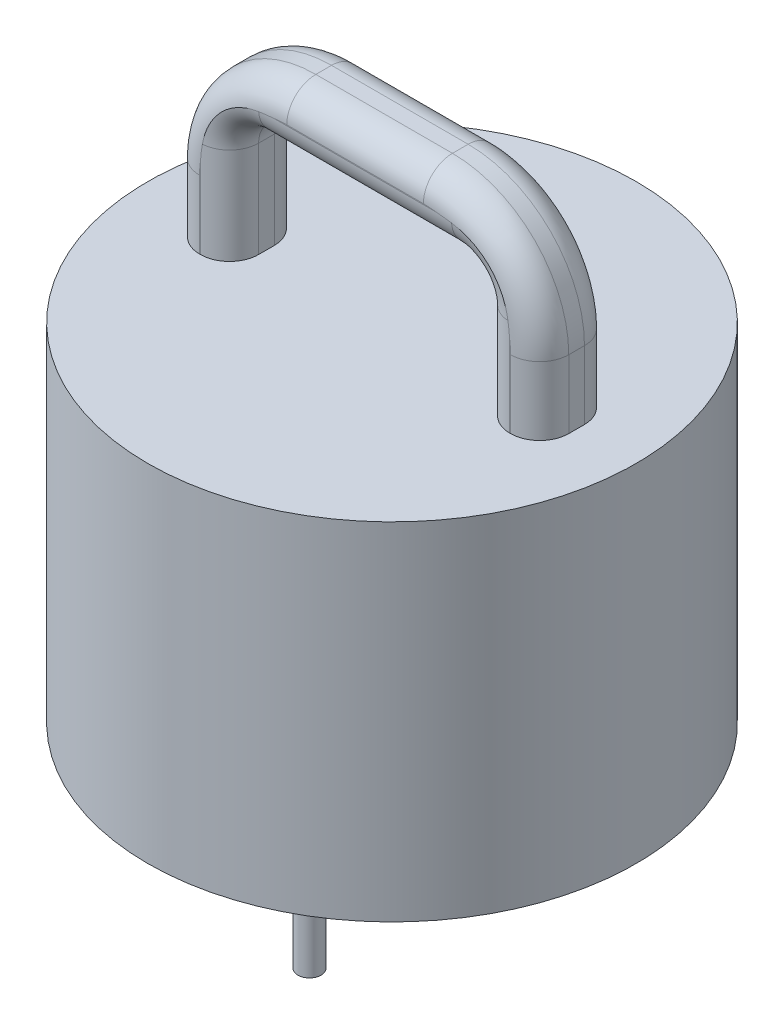
from build123d import *

# Parameters (mm, degrees)
SKETCH1_R           = 84
BOSS_EXTRUDE1_DEPTH = 203
SKETCH2_OUTSIDE_W   = 232.5
SKETCH2_OUTSIDE_H   = 232.5
SKETCH2_OUTSIDE_W_2 = 127
SKETCH2_OUTSIDE_H_2 = 25.4
CUT_EXTRUDE1_DEPTH  = 63.5
CUT_EXTRUDE2_REACH  = 242.033
SKETCH3_W           = 86.36
SKETCH3_H           = 43.18
FILLET1_R           = 10
FILLET1_R_2         = 40
SKETCH4_OUTSIDE_W   = 232.5
SKETCH4_OUTSIDE_H   = 232.5
SKETCH4_OUTSIDE_R   = 4
CUT_EXTRUDE3_DEPTH  = 20.32
SPLIT1_START        = 20.32
SPLIT1_OUTLINE_R    = 84
SPLIT1_DEPTH        = 119.18
SPLIT1_2_OUTLINE_R  = 4
SPLIT1_2_DEPTH      = 20.32
SPLIT1_3_OUTLINE_R  = 84
SPLIT1_3_DEPTH      = 139.5


# Read off the part's stored shape, not the designer's step: Split1
with BuildPart() as part:
    # Sketch1 → Boss-Extrude1 (new body)
    with BuildSketch(Plane(origin=(0, 0, 0), x_dir=(1, 0, 0), z_dir=(0, 1, 0))):
        with Locations(Location((0, 0, 0), (0, 0, 90))):
            Circle(SKETCH1_R)
    extrude(amount=BOSS_EXTRUDE1_DEPTH)

    # Sketch2 outside → Cut-Extrude1 (cut)
    with BuildSketch(Plane(origin=(0, 203, 0), x_dir=(1, 0, 0), z_dir=(0, 1, 0))):
        Rectangle(SKETCH2_OUTSIDE_W, SKETCH2_OUTSIDE_H)
        Rectangle(SKETCH2_OUTSIDE_W_2, SKETCH2_OUTSIDE_H_2, mode=Mode.SUBTRACT)
    extrude(amount=-CUT_EXTRUDE1_DEPTH, mode=Mode.SUBTRACT)

    # Sketch3 → Cut-Extrude2 (cut, up to next)
    with BuildSketch(Plane.XY.offset(12.7), mode=Mode.PRIVATE) as cut_extrude2_sk1:
        with Locations((0, 161.09)):
            Rectangle(SKETCH3_W, SKETCH3_H)
    cut_extrude2_tool1 = extrude(cut_extrude2_sk1.sketch, amount=-CUT_EXTRUDE2_REACH, mode=Mode.PRIVATE) & part.part
    add(cut_extrude2_tool1.solids().sort_by_distance((0, 161.09, 12.7))[0], mode=Mode.SUBTRACT)

    # Fillet1
    # the kernel refuses this fillet: 40, 10 mm, written as the material it adds along each edge
    with BuildSketch(Plane(origin=(-43.18, 182.68, 12.7), x_dir=(1, 0, 0), z_dir=(0, 0, -1)), Plane(origin=(43.18, 182.68, 12.7), x_dir=(0, -1, 0), z_dir=(0, 0, -1))) as fillet1_piece_1:
        with BuildLine():
            CenterArc((FILLET1_R, FILLET1_R), FILLET1_R, 180, 90)
            Line((0, FILLET1_R), (0, 0))
            Line((0, 0), (FILLET1_R, 0))
        make_face()
    extrude(amount=25.4)
    # the kernel refuses this fillet: 40, 10 mm, written as the material it takes off along each edge
    with BuildSketch(Plane(origin=(-63.5, 203, 112.7), x_dir=(0, -1, 0), z_dir=(0, 0, -1)), Plane(origin=(63.5, 203, -112.7), x_dir=(0, -1, 0), z_dir=(0, 0, 1))) as fillet1_2_piece_1:
        with BuildLine():
            CenterArc((FILLET1_R_2, -FILLET1_R_2), FILLET1_R_2, 90, 90)
            Line((0, -FILLET1_R_2), (0, 0))
            Line((0, 0), (FILLET1_R_2, 0))
        make_face()
    extrude(amount=225.4, mode=Mode.SUBTRACT)
    # the kernel refuses this fillet: 40, 10 mm, written as the material it takes off along each edge
    with BuildSketch(Plane(origin=(-43.18, 139.5, -12.7), x_dir=(-1, 0, 0), z_dir=(0, 1, 0)), Plane(origin=(43.18, 139.5, 12.7), x_dir=(1, 0, 0), z_dir=(0, 1, 0)), Plane(origin=(43.18, 172.68, -12.7), x_dir=(1, 0, 0), z_dir=(0, -1, 0))) as fillet1_3_piece_1:
        with BuildLine():
            CenterArc((FILLET1_R, FILLET1_R), FILLET1_R, 180, 90)
            Line((0, FILLET1_R), (0, 0))
            Line((0, 0), (FILLET1_R, 0))
        make_face()
    extrude(amount=33.18, mode=Mode.SUBTRACT)
    with BuildSketch(Plane(origin=(-63.5, 163, -12.7), x_dir=(1, 0, 0), z_dir=(0, -1, 0)), Plane(origin=(63.5, 163, 12.7), x_dir=(-1, 0, 0), z_dir=(0, -1, 0))) as fillet1_3_piece_2:
        with BuildLine():
            CenterArc((FILLET1_R, FILLET1_R), FILLET1_R, 180, 90)
            Line((0, FILLET1_R), (0, 0))
            Line((0, 0), (FILLET1_R, 0))
        make_face()
    extrude(amount=23.5, mode=Mode.SUBTRACT)
    with BuildSketch(Plane(origin=(-43.18, 172.68, 12.7), x_dir=(0, 0, -1), z_dir=(0, -1, 0))) as fillet1_3_piece_3:
        with BuildLine():
            CenterArc((FILLET1_R, -FILLET1_R), FILLET1_R, 90, 90)
            Line((0, -FILLET1_R), (0, 0))
            Line((0, 0), (FILLET1_R, 0))
        make_face()
    extrude(amount=33.18, mode=Mode.SUBTRACT)
    with BuildSketch(Plane(origin=(-63.5, 163, 12.7), x_dir=(1, 0, 0), z_dir=(0, -1, 0)), Plane(origin=(63.5, 163, -12.7), x_dir=(-1, 0, 0), z_dir=(0, -1, 0))) as fillet1_3_piece_4:
        with BuildLine():
            CenterArc((FILLET1_R, -FILLET1_R), FILLET1_R, 90, 90)
            Line((0, -FILLET1_R), (0, 0))
            Line((0, 0), (FILLET1_R, 0))
        make_face()
    extrude(amount=23.5, mode=Mode.SUBTRACT)
    with BuildSketch(Plane(origin=(33.18, 182.68, 12.7), x_dir=(0, 1, 0), z_dir=(-1, 0, 0)), Plane(origin=(-33.18, 182.68, -12.7), x_dir=(0, 1, 0), z_dir=(1, 0, 0))) as fillet1_3_piece_5:
        with BuildLine():
            CenterArc((FILLET1_R, FILLET1_R), FILLET1_R, 180, 90)
            Line((0, FILLET1_R), (0, 0))
            Line((0, 0), (FILLET1_R, 0))
        make_face()
    extrude(amount=66.36, mode=Mode.SUBTRACT)
    with BuildSketch(Plane(origin=(23.5, 203, 12.7), x_dir=(0, -1, 0), z_dir=(-1, 0, 0)), Plane(origin=(-23.5, 203, -12.7), x_dir=(0, -1, 0), z_dir=(1, 0, 0))) as fillet1_3_piece_6:
        with BuildLine():
            CenterArc((FILLET1_R, -FILLET1_R), FILLET1_R, 90, 90)
            Line((0, -FILLET1_R), (0, 0))
            Line((0, 0), (FILLET1_R, 0))
        make_face()
    extrude(amount=47, mode=Mode.SUBTRACT)
    with BuildSketch(Plane(origin=(23.5, 163, -12.7), x_dir=(0, 1, 0), z_dir=(-1, 0, 0))) as fillet1_3_piece_7:
        with BuildLine():
            CenterArc((40 - FILLET1_R, -FILLET1_R), FILLET1_R, 0, 90)
            Line((40, -FILLET1_R), (40, 0))
            Line((40, 0), (40 - FILLET1_R, 0))
        make_face()
    revolve(axis=Axis((23.5, 163, -12.7), (0, 0, -1)), revolution_arc=90, mode=Mode.SUBTRACT)
    with BuildSketch(Plane(origin=(23.5, 163, 12.7), x_dir=(0, 1, 0), z_dir=(-1, 0, 0))) as fillet1_3_piece_8:
        with BuildLine():
            CenterArc((40 - FILLET1_R, FILLET1_R), FILLET1_R, 270, 90)
            Line((40, FILLET1_R), (40, 0))
            Line((40, 0), (40 - FILLET1_R, 0))
        make_face()
    revolve(axis=Axis((23.5, 163, 12.7), (0, 0, -1)), revolution_arc=90, mode=Mode.SUBTRACT)
    with BuildSketch(Plane(origin=(33.18, 172.68, -12.7), x_dir=(1, 0, 0), z_dir=(0, -1, 0))) as fillet1_3_piece_9:
        with BuildLine():
            CenterArc((10 + FILLET1_R, FILLET1_R), FILLET1_R, 180, 90)
            Line((10, FILLET1_R), (10, 0))
            Line((10, 0), (10 + FILLET1_R, 0))
        make_face()
    revolve(axis=Axis((33.18, 172.68, -12.7), (0, 0, 1)), revolution_arc=90, mode=Mode.SUBTRACT)
    with BuildSketch(Plane(origin=(33.18, 172.68, 12.7), x_dir=(1, 0, 0), z_dir=(0, -1, 0))) as fillet1_3_piece_10:
        with BuildLine():
            CenterArc((10 + FILLET1_R, -FILLET1_R), FILLET1_R, 90, 90)
            Line((10, -FILLET1_R), (10, 0))
            Line((10, 0), (10 + FILLET1_R, 0))
        make_face()
    revolve(axis=Axis((33.18, 172.68, 12.7), (0, 0, 1)), revolution_arc=90, mode=Mode.SUBTRACT)
    with BuildSketch(Plane(origin=(-33.18, 172.68, -12.7), x_dir=(0, 1, 0), z_dir=(1, 0, 0))) as fillet1_3_piece_11:
        with BuildLine():
            CenterArc((10 + FILLET1_R, FILLET1_R), FILLET1_R, 180, 90)
            Line((10, FILLET1_R), (10, 0))
            Line((10, 0), (10 + FILLET1_R, 0))
        make_face()
    revolve(axis=Axis((-33.18, 172.68, -12.7), (0, 0, 1)), revolution_arc=90, mode=Mode.SUBTRACT)
    with BuildSketch(Plane(origin=(-23.5, 163, -12.7), x_dir=(0, 1, 0), z_dir=(1, 0, 0))) as fillet1_3_piece_12:
        with BuildLine():
            CenterArc((40 - FILLET1_R, FILLET1_R), FILLET1_R, 270, 90)
            Line((40, FILLET1_R), (40, 0))
            Line((40, 0), (40 - FILLET1_R, 0))
        make_face()
    revolve(axis=Axis((-23.5, 163, -12.7), (0, 0, 1)), revolution_arc=90, mode=Mode.SUBTRACT)
    with BuildSketch(Plane(origin=(-23.5, 163, 12.7), x_dir=(0, 1, 0), z_dir=(1, 0, 0))) as fillet1_3_piece_13:
        with BuildLine():
            CenterArc((40 - FILLET1_R, -FILLET1_R), FILLET1_R, 0, 90)
            Line((40, -FILLET1_R), (40, 0))
            Line((40, 0), (40 - FILLET1_R, 0))
        make_face()
    revolve(axis=Axis((-23.5, 163, 12.7), (0, 0, 1)), revolution_arc=90, mode=Mode.SUBTRACT)
    with BuildSketch(Plane(origin=(-33.18, 172.68, 12.7), x_dir=(0, 1, 0), z_dir=(1, 0, 0))) as fillet1_3_piece_14:
        with BuildLine():
            CenterArc((10 + FILLET1_R, -FILLET1_R), FILLET1_R, 90, 90)
            Line((10, -FILLET1_R), (10, 0))
            Line((10, 0), (10 + FILLET1_R, 0))
        make_face()
    revolve(axis=Axis((-33.18, 172.68, 12.7), (0, 0, 1)), revolution_arc=90, mode=Mode.SUBTRACT)

    # Sketch4 outside → Cut-Extrude3 (cut)
    with BuildSketch(Plane.XZ):
        Rectangle(SKETCH4_OUTSIDE_W, SKETCH4_OUTSIDE_H)
        with Locations(Location((-77.5, 0, 0), (0, 0, 270))):
            Circle(SKETCH4_OUTSIDE_R, mode=Mode.SUBTRACT)
        with Locations(Location((38.75, 67.116968793, 0), (0, 0, 270))):
            Circle(SKETCH4_OUTSIDE_R, mode=Mode.SUBTRACT)
        with Locations(Location((38.75, -67.116968793, 0), (0, 0, 270))):
            Circle(SKETCH4_OUTSIDE_R, mode=Mode.SUBTRACT)
    extrude(amount=-CUT_EXTRUDE3_DEPTH, mode=Mode.SUBTRACT)

    # Split1 3 outline → Split1 3 (cut)
    with BuildSketch(Plane(origin=(0, 0, 0), x_dir=(1, 0, 0), z_dir=(0, 1, 0))):
        Circle(SPLIT1_3_OUTLINE_R)
    extrude(amount=SPLIT1_3_DEPTH, mode=Mode.SUBTRACT)


with BuildPart() as body_2:
    # Split1 outline → Split1 (new body)
    with BuildSketch(Plane(origin=(0, 0, 0), x_dir=(1, 0, 0), z_dir=(0, 1, 0)).offset(SPLIT1_START)):
        Circle(SPLIT1_OUTLINE_R)
    extrude(amount=SPLIT1_DEPTH)

    # Split1 2 outline → Split1 2 (add)
    with BuildSketch(Plane(origin=(0, 0, 0), x_dir=(1, 0, 0), z_dir=(0, 1, 0))):
        with Locations((-77.5, 0)):
            Circle(SPLIT1_2_OUTLINE_R)
        with Locations((38.75, -67.116968793)):
            Circle(SPLIT1_2_OUTLINE_R)
        with Locations((38.75, 67.116968793)):
            Circle(SPLIT1_2_OUTLINE_R)
    extrude(amount=SPLIT1_2_DEPTH)


solid = Compound([part.part, body_2.part])
